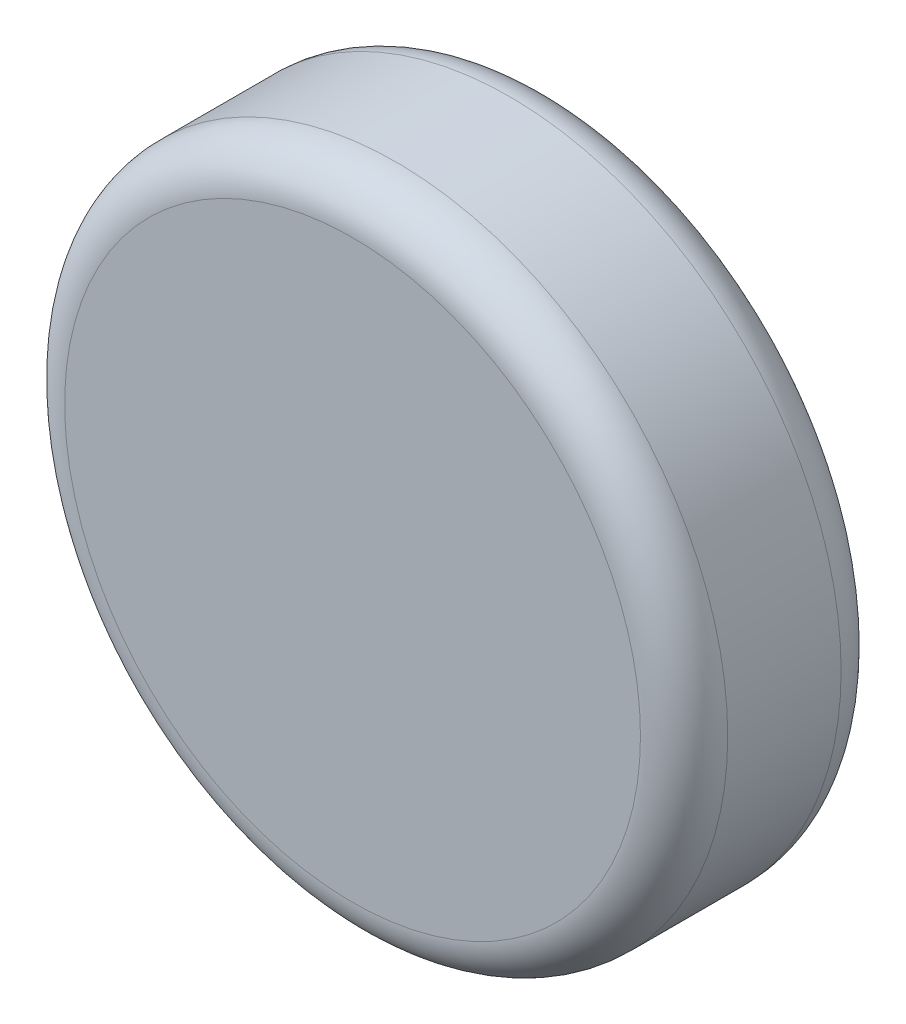
from build123d import *

# Parameters (mm, degrees)
SKETCH_2_R      = 76
EXTRUDE_2_DEPTH = 46
FILLET_1_R      = 10


with BuildPart() as part:
    # ｽｹｯﾁ2 → ﾎﾞｽ - 押し出し2 (new body)
    with BuildSketch(Plane.XY):
        Circle(SKETCH_2_R)
    extrude(amount=EXTRUDE_2_DEPTH)

    # ﾌｨﾚｯﾄ1
    fillet_1_edges = [part.edges().sort_by_distance(p)[0] for p in [
        (-76, 0, 46),
        (-76, 0, 0),
    ]]
    fillet(fillet_1_edges, radius=FILLET_1_R)


solid = part.part
